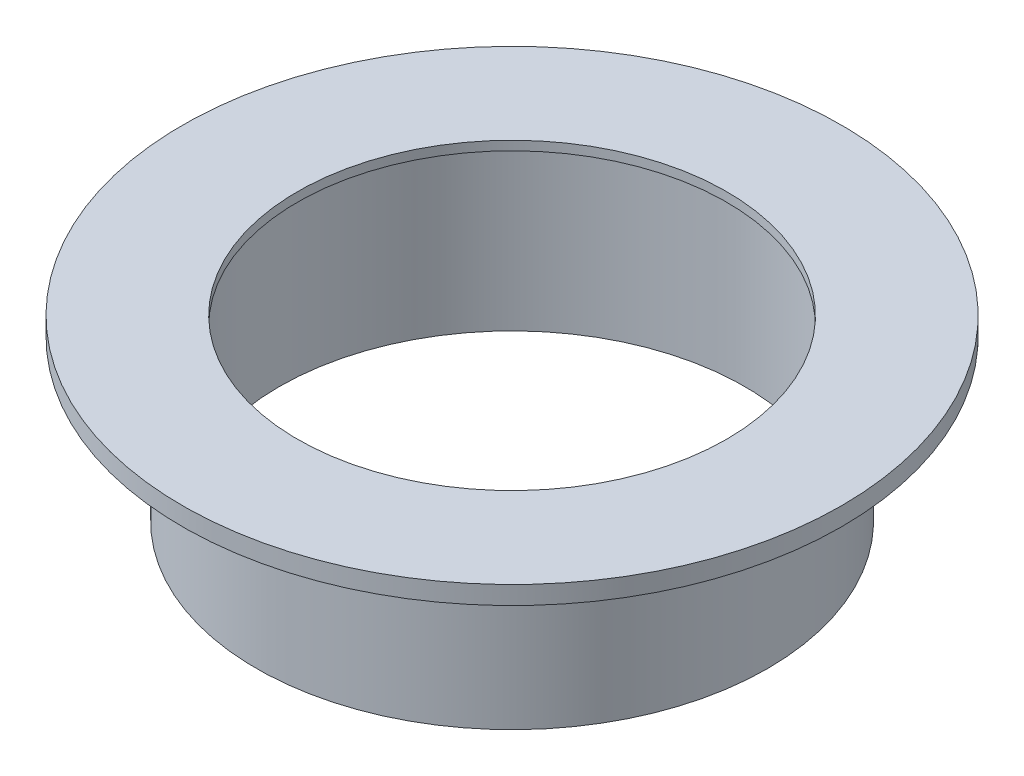
from build123d import *


with BuildPart() as part:
    # Sketch3 → FRA400 100mm (revolve)
    with BuildSketch(Plane.XY):
        Polygon((-47, -3.2), (-72.2, -3.2), (-72.2, -7.2), (-56, -7.2), (-56, -42.2), (-51, -42.2), (-51, -5.2), (-47, -5.2), align=None)
    revolve(axis=Axis((0, 0, 0), (0, 1, 0)))


solid = part.part
